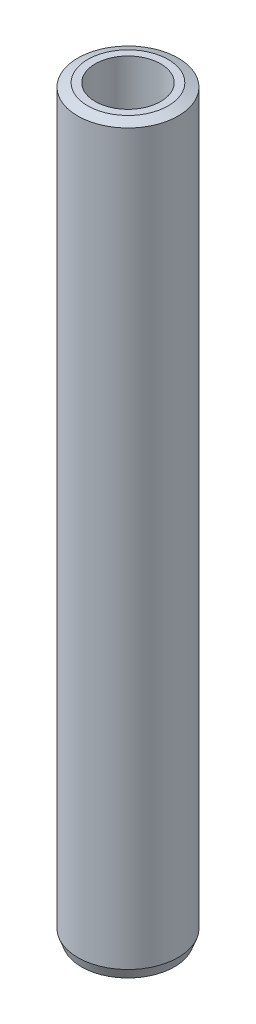
from build123d import *
from OCP.BRepFilletAPI import BRepFilletAPI_MakeChamfer

# Parameters (mm, degrees)
SKETCH1_R           = 12.5
BOSS_EXTRUDE1_DEPTH = 184.789062152
SKETCH2_R           = 8.139705959
CUT_EXTRUDE1_DEPTH  = 186.632695102
CHAMFER1_SIZE       = 0.935847544
CHAMFER1_SIZE2      = 2.49135704


with BuildPart() as part:
    # Sketch1 → Boss-Extrude1 (new body)
    with BuildSketch(Plane(origin=(0, 0, 0), x_dir=(1, 0, 0), z_dir=(0, 1, 0))):
        Circle(SKETCH1_R)
    extrude(amount=BOSS_EXTRUDE1_DEPTH)

    # Sketch2 → Cut-Extrude1 (cut, through all)
    with BuildSketch(Plane(origin=(0, 0, 0), x_dir=(1, 0, 0), z_dir=(0, 1, 0))):
        Circle(SKETCH2_R)
    extrude(amount=CUT_EXTRUDE1_DEPTH, mode=Mode.SUBTRACT)

    # Chamfer1: one chamfer whose edges measure the first distance from different faces: ONE call of the kernel's chamfer builder (chamfer() names one face for all edges)
    chamfer1_edges_1 = [part.edges().sort_by_distance(p)[0] for p in [
        (-12.5, 184.789062152, 0),
    ]]
    chamfer1_side_1 = [part.faces().sort_by_distance(p)[0] for p in [
        (-12.5, 92.394531076, 0),
    ]]
    chamfer1_edges_2 = [part.edges().sort_by_distance(p)[0] for p in [
        (-12.5, 0, 0),
    ]]
    chamfer1_side_2 = [part.faces().sort_by_distance(p)[0] for p in [
        (-12.146446609, 0, 0),
    ]]
    chamfer1 = BRepFilletAPI_MakeChamfer(part.part.solid().wrapped)
    for e in chamfer1_edges_1:
        chamfer1.Add(CHAMFER1_SIZE, CHAMFER1_SIZE2, e.wrapped, chamfer1_side_1[0].wrapped)  # the first distance lies on this face
    for e in chamfer1_edges_2:
        chamfer1.Add(CHAMFER1_SIZE, CHAMFER1_SIZE2, e.wrapped, chamfer1_side_2[0].wrapped)  # the first distance lies on this face
    add(Compound.cast(chamfer1.Shape()), mode=Mode.REPLACE)


solid = part.part
